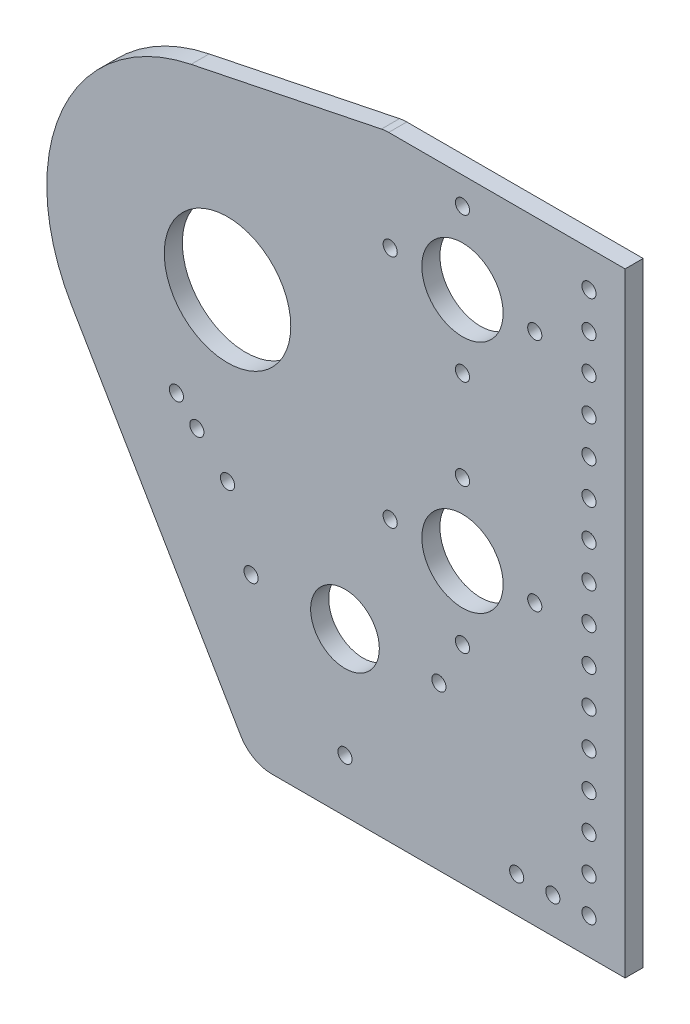
from build123d import *

# Parameters (mm, degrees)
SKETCH1_R                          = 22.225
SKETCH1_R_2                        = 14.2875
SKETCH1_R_3                        = 12.065
BOSS_EXTRUDE1_DEPTH                = 6.35
F_9_0_196_DIAMETER_HOLE1_OUTLINE_R = 2.4892
F_9_0_196_DIAMETER_HOLE1_DEPTH     = 6.35
SKETCH5_W                          = 158.475738421
SKETCH5_H                          = 23.945509926
CUT_EXTRUDE1_DEPTH                 = 198.577920905
FILLET1_R                          = 12.7


# Read off the part's stored shape, not the designer's step: #9 (0.196) Diameter Hole1
with BuildPart() as part:
    # Sketch1 → Boss-Extrude1 (new body)
    with BuildSketch(Plane(origin=(0, 0, 0), x_dir=(0, 1, 0), z_dir=(0, 0, 1))):
        with BuildLine():
            Line((80.9625, -82.55), (80.9625, -139.7))
            Line((80.9625, -139.7), (-139.573, -139.7))
            Line((-139.573, -139.7), (-139.573, -8.2804))
            Line((-139.573, -8.2804), (-32.138994776, 54.766184957))
            ThreePointArc((-32.138994776, 54.766184957), (25.818013961, 58.014482288), (62.200093141, 12.782738878))
            Line((62.200093141, 12.782738878), (80.150058213, -74.560788201))
            ThreePointArc((80.150058213, -74.560788201), (80.758867143, -78.534792445), (80.9625, -82.55))
        make_face()
        with Locations(Location((0, 0, 0), (0, 0, 270))):
            Circle(SKETCH1_R, mode=Mode.SUBTRACT)
        with Locations(Location((-41.275, -82.55, 0), (0, 0, 270))):
            Circle(SKETCH1_R_2, mode=Mode.SUBTRACT)
        with Locations(Location((41.275, -82.55, 0), (0, 0, 270))):
            Circle(SKETCH1_R_2, mode=Mode.SUBTRACT)
        with Locations(Location((-82.55, -41.275, 0), (0, 0, 270))):
            Circle(SKETCH1_R_3, mode=Mode.SUBTRACT)
    extrude(amount=BOSS_EXTRUDE1_DEPTH)

    # #9 (0.196) Diameter Hole1 outline → #9 (0.196) Diameter Hole1 (cut)
    with BuildSketch(Plane.XY):
        with Locations((101.6, -127)):
            Circle(F_9_0_196_DIAMETER_HOLE1_OUTLINE_R)
        with Locations((114.3, -127)):
            Circle(F_9_0_196_DIAMETER_HOLE1_OUTLINE_R)
        with Locations((127, 63.5)):
            Circle(F_9_0_196_DIAMETER_HOLE1_OUTLINE_R)
        with Locations((127, 50.8)):
            Circle(F_9_0_196_DIAMETER_HOLE1_OUTLINE_R)
        with Locations((127, 38.1)):
            Circle(F_9_0_196_DIAMETER_HOLE1_OUTLINE_R)
        with Locations((127, 25.4)):
            Circle(F_9_0_196_DIAMETER_HOLE1_OUTLINE_R)
        with Locations((127, 12.7)):
            Circle(F_9_0_196_DIAMETER_HOLE1_OUTLINE_R)
        with Locations((127, 0)):
            Circle(F_9_0_196_DIAMETER_HOLE1_OUTLINE_R)
        with Locations((8.2804, -82.55)):
            Circle(F_9_0_196_DIAMETER_HOLE1_OUTLINE_R)
        with Locations((41.275, -121.031)):
            Circle(F_9_0_196_DIAMETER_HOLE1_OUTLINE_R)
        with Locations((74.2696, -82.55)):
            Circle(F_9_0_196_DIAMETER_HOLE1_OUTLINE_R)
        with Locations((0, -58.355558977)):
            Circle(F_9_0_196_DIAMETER_HOLE1_OUTLINE_R)
        with Locations((-10.779281546, -47.582226654)):
            Circle(F_9_0_196_DIAMETER_HOLE1_OUTLINE_R)
        with Locations((-17.965469244, -40.400005105)):
            Circle(F_9_0_196_DIAMETER_HOLE1_OUTLINE_R)
        with Locations((127, -12.7)):
            Circle(F_9_0_196_DIAMETER_HOLE1_OUTLINE_R)
        with Locations((127, -25.4)):
            Circle(F_9_0_196_DIAMETER_HOLE1_OUTLINE_R)
        with Locations((127, -38.1)):
            Circle(F_9_0_196_DIAMETER_HOLE1_OUTLINE_R)
        with Locations((127, -50.8)):
            Circle(F_9_0_196_DIAMETER_HOLE1_OUTLINE_R)
        with Locations((127, -63.5)):
            Circle(F_9_0_196_DIAMETER_HOLE1_OUTLINE_R)
        with Locations((127, -76.2)):
            Circle(F_9_0_196_DIAMETER_HOLE1_OUTLINE_R)
        with Locations((127, -88.9)):
            Circle(F_9_0_196_DIAMETER_HOLE1_OUTLINE_R)
        with Locations((127, -101.6)):
            Circle(F_9_0_196_DIAMETER_HOLE1_OUTLINE_R)
        with Locations((127, -114.3)):
            Circle(F_9_0_196_DIAMETER_HOLE1_OUTLINE_R)
        with Locations((127, -127)):
            Circle(F_9_0_196_DIAMETER_HOLE1_OUTLINE_R)
        with Locations((107.95, -41.275)):
            Circle(F_9_0_196_DIAMETER_HOLE1_OUTLINE_R)
        with Locations((82.55, -66.675)):
            Circle(F_9_0_196_DIAMETER_HOLE1_OUTLINE_R)
        with Locations((57.15, -41.275)):
            Circle(F_9_0_196_DIAMETER_HOLE1_OUTLINE_R)
        with Locations((82.55, -15.875)):
            Circle(F_9_0_196_DIAMETER_HOLE1_OUTLINE_R)
        with Locations((82.55, 15.875)):
            Circle(F_9_0_196_DIAMETER_HOLE1_OUTLINE_R)
        with Locations((107.95, 41.275)):
            Circle(F_9_0_196_DIAMETER_HOLE1_OUTLINE_R)
        with Locations((82.55, 66.675)):
            Circle(F_9_0_196_DIAMETER_HOLE1_OUTLINE_R)
        with Locations((57.15, 41.275)):
            Circle(F_9_0_196_DIAMETER_HOLE1_OUTLINE_R)
    extrude(amount=F_9_0_196_DIAMETER_HOLE1_DEPTH, mode=Mode.SUBTRACT)

    # Sketch5 → Cut-Extrude1 (cut, through all)
    with BuildSketch(Plane.XY.offset(6.35)):
        with Locations((102.364485766, 88.172754963)):
            Rectangle(SKETCH5_W, SKETCH5_H)
    extrude(amount=-CUT_EXTRUDE1_DEPTH, mode=Mode.SUBTRACT)

    # Fillet1
    fillet1_edges = [part.edges().sort_by_distance(p)[0] for p in [
        (8.2804, -139.573, 3.175),
        (55.340025647, 76.2, 3.175),
    ]]
    fillet(fillet1_edges, radius=FILLET1_R)


solid = part.part
